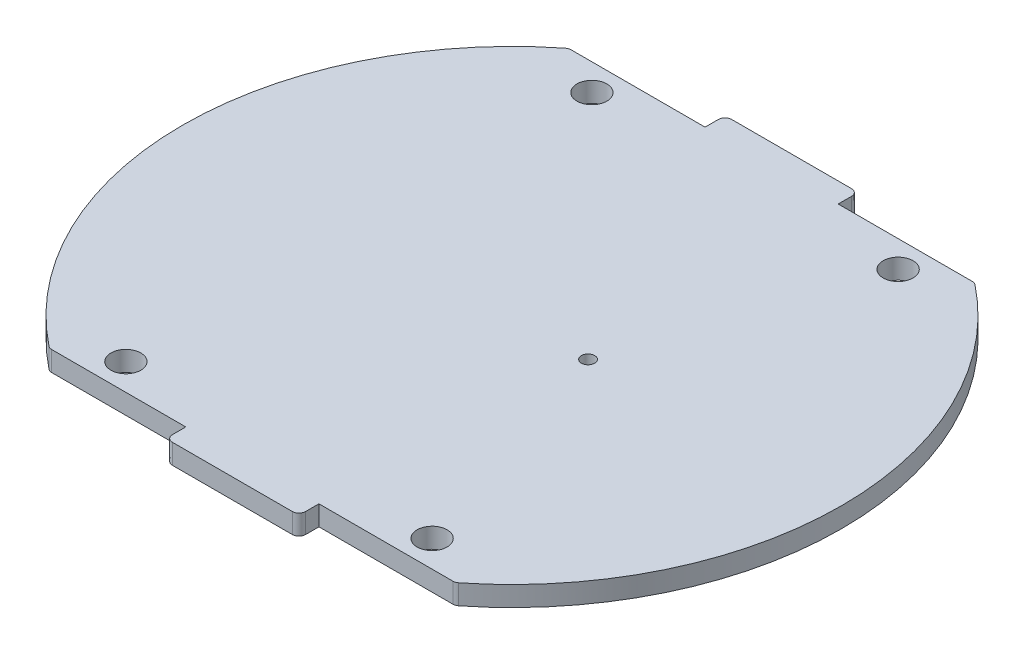
from build123d import *

# Parameters (mm, degrees)
A_BASE_T42_OUTLINE_R       = 2.2479
A_BASE_T42_OUTLINE_R_2     = 1
A_BASE_T42_DEPTH           = 3
OUTER_RIM_CUT_DEPTH        = 68.299702823
SKETCH2_W                  = 20
SKETCH2_H                  = 3
FLANGES_DEPTH              = 3
CONTOURING_R               = 1
SKETCH9_R                  = 1
SINGLE_TENDON_PORT_DEPTH   = 65.986537067
SKETCH3_W                  = 15
SKETCH3_H                  = 3
SKETCH3_W_2                = 3
SKETCH3_H_2                = 15
BASE_SUPPORTS_DEPTH        = 3
BASE_SUPPORTS_CHAMFER_SIZE = 3
SKETCH10_R                 = 1
COVER_DEPTH                = 3
SKETCH11_W                 = 15
SKETCH11_H                 = 6
SKETCH11_W_2               = 6
SKETCH11_H_2               = 15
CUT_EXTRUDE1_DEPTH         = 10
SKETCH14_W                 = 10
SKETCH14_H                 = 10
BOSS_EXTRUDE2_DEPTH        = 4.6
BOSS_EXTRUDE3_DEPTH        = 10.6
FILLET1_R                  = 1


with BuildPart() as part:
    # a_base_t42: read off the stored shape, not the designer's step
    # a_base_t42 outline → a_base_t42 (new body)
    with BuildSketch(Plane(origin=(0, 0, 0), x_dir=(1, 0, 0), z_dir=(0, 1, 0))):
        with BuildLine():
            ThreePointArc((31.5, -42), (52.5, 0), (31.5, 42))
            Line((31.5, 42), (-31.5, 42))
            ThreePointArc((-31.5, 42), (-52.5, 0), (-31.5, -42))
            Line((-31.5, -42), (31.5, -42))
        make_face()
        with Locations((-23, -35)):
            Circle(A_BASE_T42_OUTLINE_R, mode=Mode.SUBTRACT)
        with Locations((23, -35)):
            Circle(A_BASE_T42_OUTLINE_R, mode=Mode.SUBTRACT)
        with Locations((-40.25, 0)):
            Circle(A_BASE_T42_OUTLINE_R_2, mode=Mode.SUBTRACT)
        with Locations((-23, 35)):
            Circle(A_BASE_T42_OUTLINE_R, mode=Mode.SUBTRACT)
        with Locations((40.25, 0)):
            Circle(A_BASE_T42_OUTLINE_R_2, mode=Mode.SUBTRACT)
        with Locations((23, 35)):
            Circle(A_BASE_T42_OUTLINE_R, mode=Mode.SUBTRACT)
    extrude(amount=A_BASE_T42_DEPTH)

    # Sketch1 → Outer Rim Cut (cut, through all)
    with BuildSketch(Plane.XZ):
        with BuildLine():
            Line((31.5, 42), (-31.5, 42))
            ThreePointArc((-31.5, 42), (-52.5, 0), (-31.5, -42))
            Line((-31.5, -42), (31.5, -42))
            ThreePointArc((31.5, -42), (52.5, 0), (31.5, 42))
        make_face()
        with BuildLine():
            Line((30.483602149, 39), (-30.483602149, 39))
            ThreePointArc((-30.483602149, 39), (-49.5, 0), (-30.483602149, -39))
            Line((-30.483602149, -39), (30.483602149, -39))
            ThreePointArc((30.483602149, -39), (49.5, 0), (30.483602149, 39))
        make_face(mode=Mode.SUBTRACT)
    extrude(amount=-OUTER_RIM_CUT_DEPTH, mode=Mode.SUBTRACT)

    # Sketch2 → Flanges (add)
    with BuildSketch(Plane.XZ):
        with Locations((0, -40.5)):
            Rectangle(SKETCH2_W, SKETCH2_H)
        with Locations((0, 40.5)):
            Rectangle(SKETCH2_W, SKETCH2_H)
    extrude(amount=-FLANGES_DEPTH)

    # Contouring
    contouring_edges = [part.edges().sort_by_distance(p)[0] for p in [
        (30.483602149, 1.5, -39),
        (-30.483602149, 1.5, -39),
        (10, 1.5, -42),
        (-10, 1.5, -42),
        (30.483602149, 1.5, 39),
        (-30.483602149, 1.5, 39),
        (10, 1.5, 42),
        (-10, 1.5, 42),
    ]]
    fillet(contouring_edges, radius=CONTOURING_R)

    # Sketch9 → Single Tendon Port (cut, through all)
    with BuildSketch(Plane.XZ):
        with Locations(Location((11.425, 0, 0), (0, 0, 270))):
            Circle(SKETCH9_R)
    extrude(amount=-SINGLE_TENDON_PORT_DEPTH, mode=Mode.SUBTRACT)

    # Sketch3 → Base Supports (add)
    with BuildSketch(Plane.XZ):
        with Locations((-25.325, -27)):
            Rectangle(SKETCH3_W, SKETCH3_H)
        with Locations((-25.325, 27)):
            Rectangle(SKETCH3_W, SKETCH3_H)
        with Locations((-34.325, -12.5)):
            Rectangle(SKETCH3_W_2, SKETCH3_H_2)
        with Locations((-34.325, 12.5)):
            Rectangle(SKETCH3_W_2, SKETCH3_H_2)
    extrude(amount=BASE_SUPPORTS_DEPTH)

    # Base Supports Chamfer
    # the kernel refuses this chamfer: 3 mm, written as the material it adds along each edge
    with BuildSketch(Plane(origin=(-32.825, 0, 28.5), x_dir=(0, 0, 1), z_dir=(1, 0, 0))) as base_supports_chamfer_piece_1_section:
        Polygon((BASE_SUPPORTS_CHAMFER_SIZE, 0), (0, BASE_SUPPORTS_CHAMFER_SIZE), (0, 0), align=None)
    base_supports_chamfer_piece_1 = extrude(amount=15, mode=Mode.PRIVATE)
    base_supports_chamfer_piece_1 = split(base_supports_chamfer_piece_1, bisect_by=Plane(origin=(-32.825, -3, 28.5), z_dir=(0, 1, 0)), keep=Keep.TOP, mode=Mode.PRIVATE)
    add(base_supports_chamfer_piece_1)
    with BuildSketch(Plane(origin=(-17.825, 0, -28.5), x_dir=(0, 0, -1), z_dir=(-1, 0, 0))) as base_supports_chamfer_piece_2_section:
        Polygon((BASE_SUPPORTS_CHAMFER_SIZE, 0), (0, BASE_SUPPORTS_CHAMFER_SIZE), (0, 0), align=None)
    base_supports_chamfer_piece_2 = extrude(amount=15, mode=Mode.PRIVATE)
    base_supports_chamfer_piece_2 = split(base_supports_chamfer_piece_2, bisect_by=Plane(origin=(-17.825, -3, -28.5), z_dir=(0, 1, 0)), keep=Keep.TOP, mode=Mode.PRIVATE)
    add(base_supports_chamfer_piece_2)
    with BuildSketch(Plane(origin=(-35.825, 0, 20), x_dir=(-1, 0, 0), z_dir=(0, 0, -1))) as base_supports_chamfer_piece_3_section:
        Polygon((BASE_SUPPORTS_CHAMFER_SIZE, 0), (0, -BASE_SUPPORTS_CHAMFER_SIZE), (0, 0), align=None)
    base_supports_chamfer_piece_3 = extrude(amount=15, mode=Mode.PRIVATE)
    base_supports_chamfer_piece_3 = split(base_supports_chamfer_piece_3, bisect_by=Plane(origin=(-35.825, -3, 20), z_dir=(0, 1, 0)), keep=Keep.TOP, mode=Mode.PRIVATE)
    add(base_supports_chamfer_piece_3)
    with BuildSketch(Plane(origin=(-35.825, 0, -20), x_dir=(-1, 0, 0), z_dir=(0, 0, 1))) as base_supports_chamfer_piece_4_section:
        Polygon((BASE_SUPPORTS_CHAMFER_SIZE, 0), (0, BASE_SUPPORTS_CHAMFER_SIZE), (0, 0), align=None)
    base_supports_chamfer_piece_4 = extrude(amount=15, mode=Mode.PRIVATE)
    base_supports_chamfer_piece_4 = split(base_supports_chamfer_piece_4, bisect_by=Plane(origin=(-35.825, -3, -20), z_dir=(0, 1, 0)), keep=Keep.TOP, mode=Mode.PRIVATE)
    add(base_supports_chamfer_piece_4)

    # Sketch10 → Cover (add)
    with BuildSketch(Plane.XZ):
        with Locations((-40.25, 0)):
            Circle(SKETCH10_R)
        with Locations((40.25, 0)):
            Circle(SKETCH10_R)
    extrude(amount=-COVER_DEPTH)

    # Sketch11 → Cut-Extrude1 (cut)
    with BuildSketch(Plane.XZ):
        with Locations((-25.325, 28.5)):
            Rectangle(SKETCH11_W, SKETCH11_H)
        with Locations((-35.825, 12.5)):
            Rectangle(SKETCH11_W_2, SKETCH11_H_2)
        with Locations((-35.825, -12.5)):
            Rectangle(SKETCH11_W_2, SKETCH11_H_2)
        with Locations((-25.325, -28.5)):
            Rectangle(SKETCH11_W, SKETCH11_H)
    extrude(amount=CUT_EXTRUDE1_DEPTH, mode=Mode.SUBTRACT)

    # Sketch14 → Boss-Extrude2 (add)
    with BuildSketch(Plane.XZ):
        with Locations((-23.7, 19.95)):
            Rectangle(SKETCH14_W, SKETCH14_H)
        with Locations((0.7, 19.95)):
            Rectangle(SKETCH14_W, SKETCH14_H)
        with Locations((0.7, -16.95)):
            Rectangle(SKETCH14_W, SKETCH14_H)
        with Locations((-23.7, -16.95)):
            Rectangle(SKETCH14_W, SKETCH14_H)
    extrude(amount=BOSS_EXTRUDE2_DEPTH)

    # Sketch15 → Boss-Extrude3 (add)
    with BuildSketch(Plane.XZ):
        Polygon((-28.7, 24.95), (-28.7, 15.7), (-32.7, 15.7), (-32.7, 28.95), (9.7, 28.95), (9.7, 10.95), (5.7, 10.95), (5.7, 24.95), align=None)
        Polygon((-28.7, -21.95), (-28.7, 0.7), (-32.7, 0.7), (-32.7, -25.95), (5.7, -25.95), (5.7, -21.95), align=None)
    extrude(amount=BOSS_EXTRUDE3_DEPTH)

    # Fillet1
    # the kernel refuses this fillet: 1 mm, written as the material it adds along each edge
    with BuildSketch(Plane(origin=(-18.7, 2.5, 24.95), x_dir=(1, 0, 0), z_dir=(0, -1, 0)), Plane(origin=(-4.3, 2.5, 24.95), x_dir=(0, 0, -1), z_dir=(0, -1, 0)), Plane(origin=(5.7, 2.5, 14.95), x_dir=(0, 0, -1), z_dir=(0, -1, 0)), Plane(origin=(-4.3, 2.5, -21.95), x_dir=(-1, 0, 0), z_dir=(0, -1, 0)), Plane(origin=(-18.7, 2.5, -21.95), x_dir=(0, 0, 1), z_dir=(0, -1, 0)), Plane(origin=(-28.7, 2.5, -11.95), x_dir=(0, 0, 1), z_dir=(0, -1, 0))) as fillet1_piece_1:
        with BuildLine():
            CenterArc((FILLET1_R, -FILLET1_R), FILLET1_R, 90, 90)
            Line((0, -FILLET1_R), (0, 0))
            Line((0, 0), (FILLET1_R, 0))
        make_face()
    extrude(amount=7.1)
    # the kernel refuses this fillet: 1 mm, written as the material it takes off along each edge
    with BuildSketch(Plane(origin=(-31.7, -9.6, -0.3), x_dir=(0, 0, 1), z_dir=(0, -1, 0))) as fillet1_2_piece_1_section:
        Polygon((0, 0), (FILLET1_R * 1.02, 0), (FILLET1_R * 1.02, FILLET1_R * 1.02), (0, FILLET1_R * 1.02), align=None)
    fillet1_2_piece_1 = extrude(amount=FILLET1_R * 1.02, mode=Mode.PRIVATE)
    fillet1_2_piece_1 = fillet1_2_piece_1 - Plane(origin=(-31.7, -9.6, -0.3), x_dir=(0.7071067811865477, 0, -0.7071067811865475), z_dir=(0, -1, 0)) * Sphere(FILLET1_R, mode=Mode.PRIVATE)
    add(fillet1_2_piece_1, mode=Mode.SUBTRACT)
    with BuildSketch(Plane(origin=(-31.7, -9.6, -24.95), x_dir=(-1, 0, 0), z_dir=(0, -1, 0))) as fillet1_2_piece_2_section:
        Polygon((0, 0), (FILLET1_R * 1.02, 0), (FILLET1_R * 1.02, FILLET1_R * 1.02), (0, FILLET1_R * 1.02), align=None)
    fillet1_2_piece_2 = extrude(amount=FILLET1_R * 1.02, mode=Mode.PRIVATE)
    fillet1_2_piece_2 = fillet1_2_piece_2 - Plane(origin=(-31.7, -9.6, -24.95), x_dir=(0.7071067811865475, 0, 0.7071067811865475), z_dir=(0, -1, 0)) * Sphere(FILLET1_R, mode=Mode.PRIVATE)
    add(fillet1_2_piece_2, mode=Mode.SUBTRACT)
    with BuildSketch(Plane(origin=(4.7, -9.6, -24.95), x_dir=(0, 0, -1), z_dir=(0, -1, 0))) as fillet1_2_piece_3_section:
        Polygon((0, 0), (FILLET1_R * 1.02, 0), (FILLET1_R * 1.02, FILLET1_R * 1.02), (0, FILLET1_R * 1.02), align=None)
    fillet1_2_piece_3 = extrude(amount=FILLET1_R * 1.02, mode=Mode.PRIVATE)
    fillet1_2_piece_3 = fillet1_2_piece_3 - Plane(origin=(4.7, -9.6, -24.95), x_dir=(-0.7071067811865475, 0, 0.7071067811865475), z_dir=(0, -1, 0)) * Sphere(FILLET1_R, mode=Mode.PRIVATE)
    add(fillet1_2_piece_3, mode=Mode.SUBTRACT)
    with BuildSketch(Plane(origin=(8.7, -9.6, 27.95), x_dir=(1, 0, 0), z_dir=(0, -1, 0))) as fillet1_2_piece_4_section:
        Polygon((0, 0), (FILLET1_R * 1.02, 0), (FILLET1_R * 1.02, FILLET1_R * 1.02), (0, FILLET1_R * 1.02), align=None)
    fillet1_2_piece_4 = extrude(amount=FILLET1_R * 1.02, mode=Mode.PRIVATE)
    fillet1_2_piece_4 = fillet1_2_piece_4 - Plane(origin=(8.7, -9.6, 27.95), x_dir=(-0.7071067811865475, 0, -0.7071067811865475), z_dir=(0, -1, 0)) * Sphere(FILLET1_R, mode=Mode.PRIVATE)
    add(fillet1_2_piece_4, mode=Mode.SUBTRACT)
    with BuildSketch(Plane(origin=(8.7, -9.6, 11.95), x_dir=(1, 0, 0), z_dir=(0, -1, 0))) as fillet1_2_piece_5_section:
        Polygon((0, 0), (FILLET1_R * 1.02, 0), (FILLET1_R * 1.02, -FILLET1_R * 1.02), (0, -FILLET1_R * 1.02), align=None)
    fillet1_2_piece_5 = extrude(amount=FILLET1_R * 1.02, mode=Mode.PRIVATE)
    fillet1_2_piece_5 = fillet1_2_piece_5 - Plane(origin=(8.7, -9.6, 11.95), x_dir=(-0.7071067811865475, 0, 0.7071067811865475), z_dir=(0, -1, 0)) * Sphere(FILLET1_R, mode=Mode.PRIVATE)
    add(fillet1_2_piece_5, mode=Mode.SUBTRACT)
    with BuildSketch(Plane(origin=(-31.7, -9.6, 16.7), x_dir=(-1, 0, 0), z_dir=(0, -1, 0))) as fillet1_2_piece_6_section:
        Polygon((0, 0), (FILLET1_R * 1.02, 0), (FILLET1_R * 1.02, FILLET1_R * 1.02), (0, FILLET1_R * 1.02), align=None)
    fillet1_2_piece_6 = extrude(amount=FILLET1_R * 1.02, mode=Mode.PRIVATE)
    fillet1_2_piece_6 = fillet1_2_piece_6 - Plane(origin=(-31.7, -9.6, 16.7), x_dir=(0.7071067811865475, 0, 0.7071067811865475), z_dir=(0, -1, 0)) * Sphere(FILLET1_R, mode=Mode.PRIVATE)
    add(fillet1_2_piece_6, mode=Mode.SUBTRACT)
    with BuildSketch(Plane(origin=(-31.7, -9.6, 27.95), x_dir=(0, 0, 1), z_dir=(0, -1, 0))) as fillet1_2_piece_7_section:
        Polygon((0, 0), (FILLET1_R * 1.02, 0), (FILLET1_R * 1.02, FILLET1_R * 1.02), (0, FILLET1_R * 1.02), align=None)
    fillet1_2_piece_7 = extrude(amount=FILLET1_R * 1.02, mode=Mode.PRIVATE)
    fillet1_2_piece_7 = fillet1_2_piece_7 - Plane(origin=(-31.7, -9.6, 27.95), x_dir=(0.7071067811865475, 0, -0.7071067811865475), z_dir=(0, -1, 0)) * Sphere(FILLET1_R, mode=Mode.PRIVATE)
    add(fillet1_2_piece_7, mode=Mode.SUBTRACT)
    with BuildSketch(Plane(origin=(-4.3, 0, 14.95), x_dir=(0, 0, 1), z_dir=(0, -1, 0)), Plane(origin=(5.7, 0, -11.95), x_dir=(0, 0, -1), z_dir=(0, -1, 0)), Plane(origin=(-4.3, 0, -11.95), x_dir=(1, 0, 0), z_dir=(0, -1, 0)), Plane(origin=(-18.7, 0, 14.95), x_dir=(-1, 0, 0), z_dir=(0, -1, 0))) as fillet1_2_piece_8:
        with BuildLine():
            CenterArc((FILLET1_R, -FILLET1_R), FILLET1_R, 90, 90)
            Line((0, -FILLET1_R), (0, 0))
            Line((0, 0), (FILLET1_R, 0))
        make_face()
    extrude(amount=7.1, mode=Mode.SUBTRACT)
    with BuildSketch(Plane(origin=(-18.7, 0, -11.95), x_dir=(-1, 0, 0), z_dir=(0, -1, 0))) as fillet1_2_piece_9:
        with BuildLine():
            CenterArc((FILLET1_R, FILLET1_R), FILLET1_R, 180, 90)
            Line((0, FILLET1_R), (0, 0))
            Line((0, 0), (FILLET1_R, 0))
        make_face()
    extrude(amount=7.1, mode=Mode.SUBTRACT)
    with BuildSketch(Plane(origin=(-28.7, 0, 14.95), x_dir=(0, 0, 1), z_dir=(0, -1, 0))) as fillet1_2_piece_10:
        with BuildLine():
            CenterArc((1, -0.968245837), FILLET1_R, 104.477512186, 75.522487814)
            Line((0, -0.968245837), (0, 0))
            Line((0, 0), (0.75, 0))
        make_face()
    extrude(amount=7.020614591, mode=Mode.SUBTRACT)
    with BuildSketch(Plane(origin=(-32.7, -10.6, -0.3), x_dir=(1, 0, 0), z_dir=(0, 0, -1))) as fillet1_2_piece_11:
        with BuildLine():
            CenterArc((FILLET1_R, -FILLET1_R), FILLET1_R, 90, 90)
            Line((0, -FILLET1_R), (0, 0))
            Line((0, 0), (FILLET1_R, 0))
        make_face()
    extrude(amount=24.65, mode=Mode.SUBTRACT)
    with BuildSketch(Plane(origin=(-31.7, -10.6, -25.95), x_dir=(0, 0, 1), z_dir=(1, 0, 0))) as fillet1_2_piece_12:
        with BuildLine():
            CenterArc((FILLET1_R, -FILLET1_R), FILLET1_R, 90, 90)
            Line((0, -FILLET1_R), (0, 0))
            Line((0, 0), (FILLET1_R, 0))
        make_face()
    extrude(amount=36.4, mode=Mode.SUBTRACT)
    with BuildSketch(Plane(origin=(5.7, -10.6, -24.95), x_dir=(-1, 0, 0), z_dir=(0, 0, 1)), Plane(origin=(-26.2, -10.6, 0.7), x_dir=(0, 0, -1), z_dir=(-1, 0, 0))) as fillet1_2_piece_13:
        with BuildLine():
            CenterArc((FILLET1_R, -FILLET1_R), FILLET1_R, 90, 90)
            Line((0, -FILLET1_R), (0, 0))
            Line((0, 0), (FILLET1_R, 0))
        make_face()
    extrude(amount=5.5, mode=Mode.SUBTRACT)
    with BuildSketch(Plane(origin=(9.7, -10.6, 27.95), x_dir=(-1, 0, 0), z_dir=(0, 0, -1))) as fillet1_2_piece_14:
        with BuildLine():
            CenterArc((FILLET1_R, FILLET1_R), FILLET1_R, 180, 90)
            Line((0, FILLET1_R), (0, 0))
            Line((0, 0), (FILLET1_R, 0))
        make_face()
    extrude(amount=16, mode=Mode.SUBTRACT)
    with BuildSketch(Plane(origin=(-32.7, -10.6, 16.7), x_dir=(1, 0, 0), z_dir=(0, 0, 1))) as fillet1_2_piece_15:
        with BuildLine():
            CenterArc((FILLET1_R, FILLET1_R), FILLET1_R, 180, 90)
            Line((0, FILLET1_R), (0, 0))
            Line((0, 0), (FILLET1_R, 0))
        make_face()
    extrude(amount=11.25, mode=Mode.SUBTRACT)
    with BuildSketch(Plane(origin=(-31.7, -10.6, 28.95), x_dir=(0, 0, -1), z_dir=(1, 0, 0))) as fillet1_2_piece_16:
        with BuildLine():
            CenterArc((FILLET1_R, FILLET1_R), FILLET1_R, 180, 90)
            Line((0, FILLET1_R), (0, 0))
            Line((0, 0), (FILLET1_R, 0))
        make_face()
    extrude(amount=40.4, mode=Mode.SUBTRACT)
    with BuildSketch(Plane(origin=(-32.7, 0, 28.95), x_dir=(1, 0, 0), z_dir=(0, -1, 0)), Plane(origin=(9.7, 0, 28.95), x_dir=(0, 0, -1), z_dir=(0, -1, 0)), Plane(origin=(9.7, 0, 10.95), x_dir=(-1, 0, 0), z_dir=(0, -1, 0)), Plane(origin=(5.7, 0, -25.95), x_dir=(-1, 0, 0), z_dir=(0, -1, 0)), Plane(origin=(-32.7, 0, -25.95), x_dir=(0, 0, 1), z_dir=(0, -1, 0)), Plane(origin=(-32.7, 0, 0.7), x_dir=(1, 0, 0), z_dir=(0, -1, 0)), Plane(origin=(-32.7, 0, 15.7), x_dir=(0, 0, 1), z_dir=(0, -1, 0))) as fillet1_2_piece_17:
        with BuildLine():
            CenterArc((FILLET1_R, -FILLET1_R), FILLET1_R, 90, 90)
            Line((0, -FILLET1_R), (0, 0))
            Line((0, 0), (FILLET1_R, 0))
        make_face()
    extrude(amount=9.6, mode=Mode.SUBTRACT)
    with BuildSketch(Plane(origin=(8.7, -10.6, 10.95), x_dir=(0, 0, 1), z_dir=(-1, 0, 0)), Plane(origin=(-26.2, -10.6, 15.7), x_dir=(0, 0, 1), z_dir=(-1, 0, 0))) as fillet1_2_piece_18:
        with BuildLine():
            CenterArc((FILLET1_R, FILLET1_R), FILLET1_R, 180, 90)
            Line((0, FILLET1_R), (0, 0))
            Line((0, 0), (FILLET1_R, 0))
        make_face()
    extrude(amount=5.5, mode=Mode.SUBTRACT)


solid = part.part
